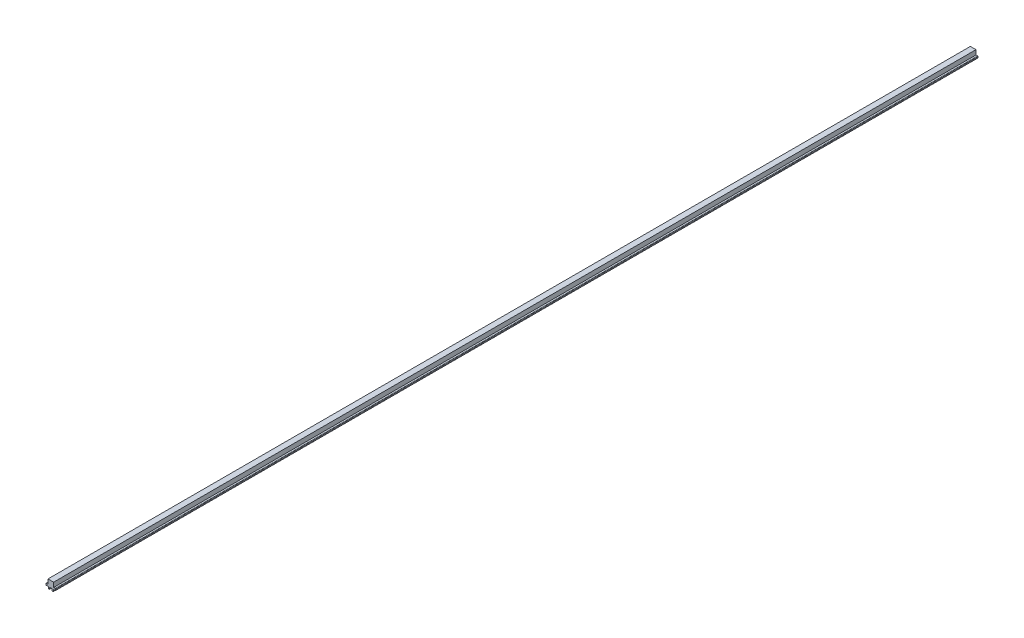
from build123d import *

# Parameters (mm, degrees)
BOSS_EXTRUDE1_DEPTH = 1000
FILLET1_R           = 0.5
FILLET2_R           = 0.5


with BuildPart() as part:
    # Sketch2 → Boss-Extrude1 (new body)
    with BuildSketch(Plane.XY):
        Polygon((1.633353761, 5.126842427), (-4.466646239, 5.126842427), (-4.466646239, 0.126842427), (-6.666646239, 0.126842427), (-6.666646239, -1.873157573), (-4.216646239, -1.873157573), (-4.216646239, -4.073157573), (-2.716646239, -4.073157573), (-2.716646239, -1.873157573), (-0.116646239, -1.873157573), (-0.116646239, -4.073157573), (1.383353761, -4.073157573), (1.383353761, -1.873157573), (3.833353761, -1.873157573), (3.833353761, 0.126842427), (1.633353761, 0.126842427), align=None)
    extrude(amount=BOSS_EXTRUDE1_DEPTH)

    # Fillet1
    fillet1_edges = [part.edges().sort_by_distance(p)[0] for p in [
        (3.833353761, -1.873157573, 500),
        (3.833353761, 0.126842427, 500),
        (-6.666646239, -1.873157573, 500),
        (-6.666646239, 0.126842427, 500),
    ]]
    fillet(fillet1_edges, radius=FILLET1_R)

    # Fillet2
    fillet2_edges = [part.edges().sort_by_distance(p)[0] for p in [
        (1.383353761, -4.073157573, 500),
        (-0.116646239, -4.073157573, 500),
        (-4.216646239, -4.073157573, 500),
        (-2.716646239, -4.073157573, 500),
    ]]
    fillet(fillet2_edges, radius=FILLET2_R)


solid = part.part
